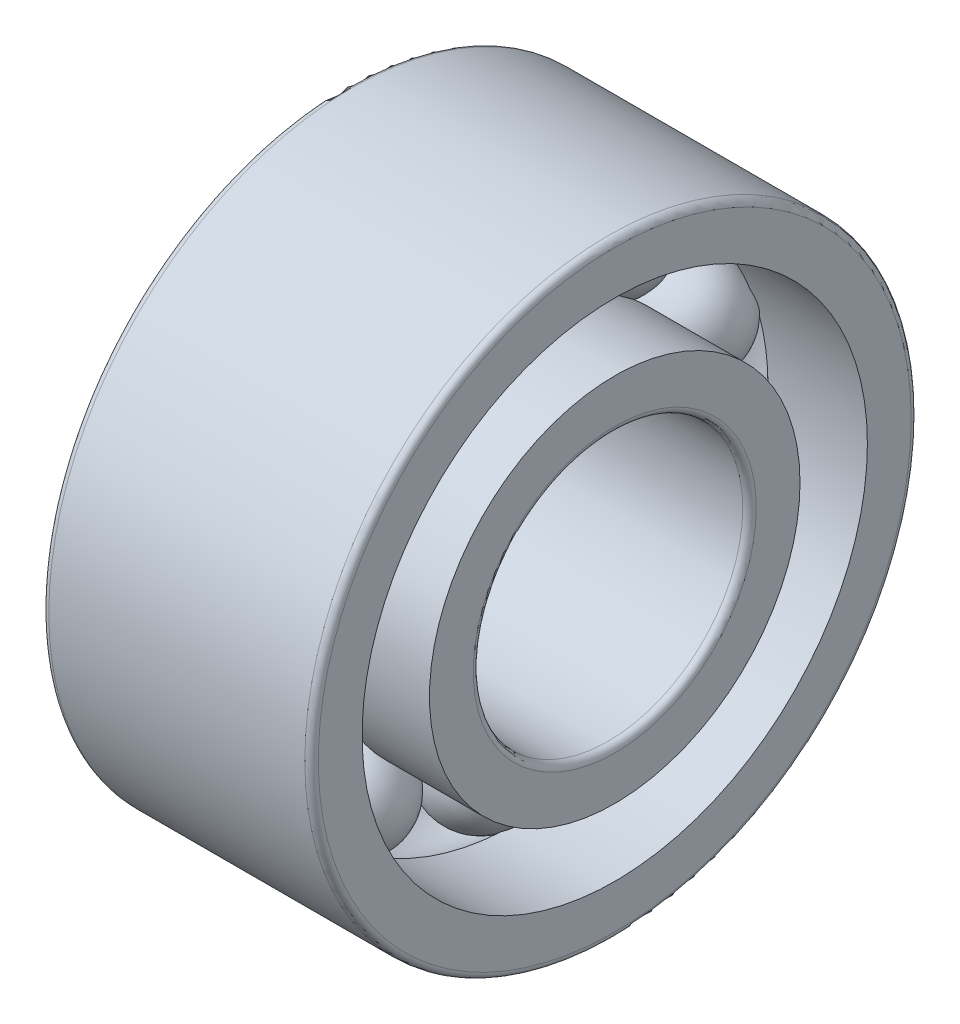
from build123d import *

# Parameters (mm, degrees)
CAGSPISKE_W         = 0.15
CAGSPISKE_H         = 0.25
CAGESPINE_ANGLE     = 0.001
BALLSDETAILED_COUNT = 10
BALLSDETAILED_ANGLE = 324


with BuildPart() as part:
    # CagSpiSke → CageSpine (revolve)
    with BuildSketch(Plane.XY):
        with Locations((0, 3.25)):
            Rectangle(CAGSPISKE_W, CAGSPISKE_H)
    revolve(axis=Axis((-20.6375, 0, 0), (-1, 0, 0)), revolution_arc=CAGESPINE_ANGLE)

    # BalDetSke → BallDetailed (revolve)
    with BuildSketch(Plane.XY):
        with BuildLine():
            Line((-0.75, 3.25), (0.75, 3.25))
            ThreePointArc((0.75, 3.25), (0, 2.5), (-0.75, 3.25))
        make_face()
    balldetailed = revolve(axis=Axis((-1.905, 3.25, 0), (1, 0, 0)))

    # InnRacSke → InnerRace (revolve)
    with BuildSketch(Plane.XY):
        with BuildLine():
            Line((-0.525, 2.75), (-2, 2.75))
            Line((-2, 2.75), (-2, 2.1))
            ThreePointArc((-2, 2.1), (-1.970710678, 2.029289322), (-1.9, 2))
            Line((-1.9, 2), (1.9, 2))
            ThreePointArc((1.9, 2), (1.970710678, 2.029289322), (2, 2.1))
            Line((2, 2.1), (2, 2.75))
            Line((2, 2.75), (0.525, 2.75))
            ThreePointArc((0.525, 2.75), (0, 2.525), (-0.525, 2.75))
        make_face()
    revolve(axis=Axis((-20.6375, 0, 0), (1, 0, 0)))

    # OutRacSke → OuterRace (revolve)
    with BuildSketch(Plane.XY):
        with BuildLine():
            Line((-0.525, 3.75), (-2, 3.75))
            Line((-2, 3.75), (-2, 4.4))
            ThreePointArc((-2, 4.4), (-1.970710678, 4.470710678), (-1.9, 4.5))
            Line((-1.9, 4.5), (1.9, 4.5))
            ThreePointArc((1.9, 4.5), (1.970710678, 4.470710678), (2, 4.4))
            Line((2, 4.4), (2, 3.75))
            Line((2, 3.75), (0.525, 3.75))
            ThreePointArc((0.525, 3.75), (0, 3.975), (-0.525, 3.75))
        make_face()
    revolve(axis=Axis((-20.6375, 0, 0), (1, 0, 0)))

    # BallsDetailed: BallDetailed ×10 about axis
    ballsdetailed_axis = Axis((-50, 0, 0), (1, 0, 0))
    for i in range(1, BALLSDETAILED_COUNT):
        add(balldetailed.rotate(ballsdetailed_axis, i * BALLSDETAILED_ANGLE / (BALLSDETAILED_COUNT - 1)))


solid = part.part
